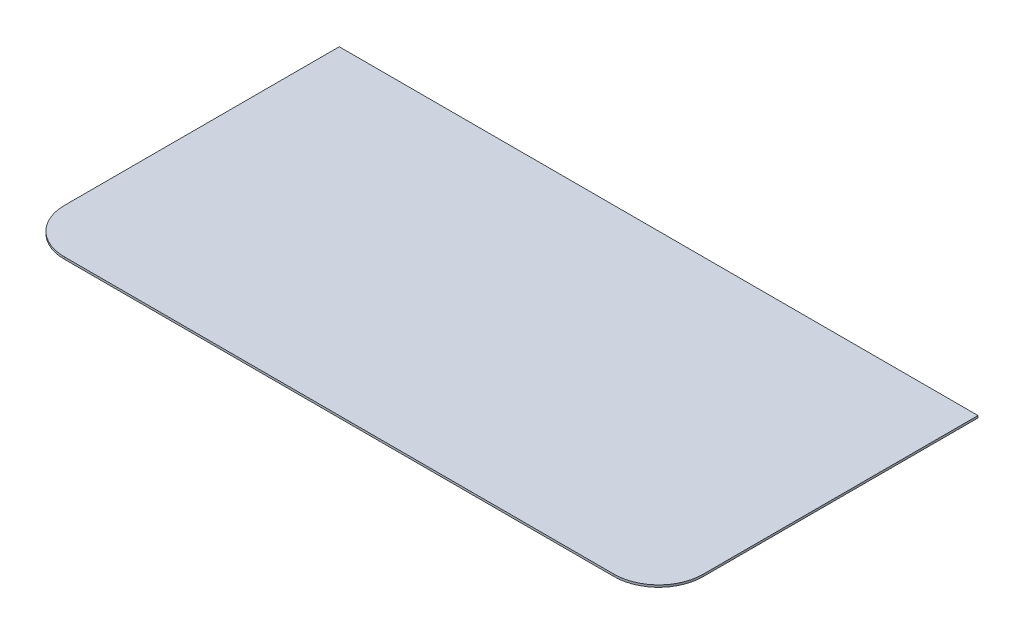
from build123d import *

# Parameters (mm, degrees)
SKIZZE1_W                  = 151
SKIZZE1_H                  = 151
LINEAR_AUSTRAGEN1_DEPTH    = 1
VERRUNDUNG1_R              = 21
VERRUNDUNG1_OF_SPIEGELN1_R = 21


with BuildPart() as part:
    # Skizze1 → Linear austragen1 (new body)
    with BuildSketch(Plane(origin=(0, 0, 0), x_dir=(1, 0, 0), z_dir=(0, 1, 0))):
        with Locations((75.5, 75.5)):
            Rectangle(SKIZZE1_W, SKIZZE1_H)
    linear_austragen1 = extrude(amount=LINEAR_AUSTRAGEN1_DEPTH)

    # Verrundung1
    verrundung1_edges = [part.edges().sort_by_distance(p)[0] for p in [
        (151, 0.5, 0),
    ]]
    fillet(verrundung1_edges, radius=VERRUNDUNG1_R)

    # Spiegeln1: Linear austragen1 across plane
    add(linear_austragen1.mirror(Plane(origin=(0, 1, 0), x_dir=(0, 0, 1), z_dir=(1, 0, 0))))

    # Verrundung1 of Spiegeln1
    verrundung1_of_spiegeln1_edges = [part.edges().sort_by_distance(p)[0] for p in [
        (-151, 0.5, 0),
    ]]
    fillet(verrundung1_of_spiegeln1_edges, radius=VERRUNDUNG1_OF_SPIEGELN1_R)


solid = part.part
